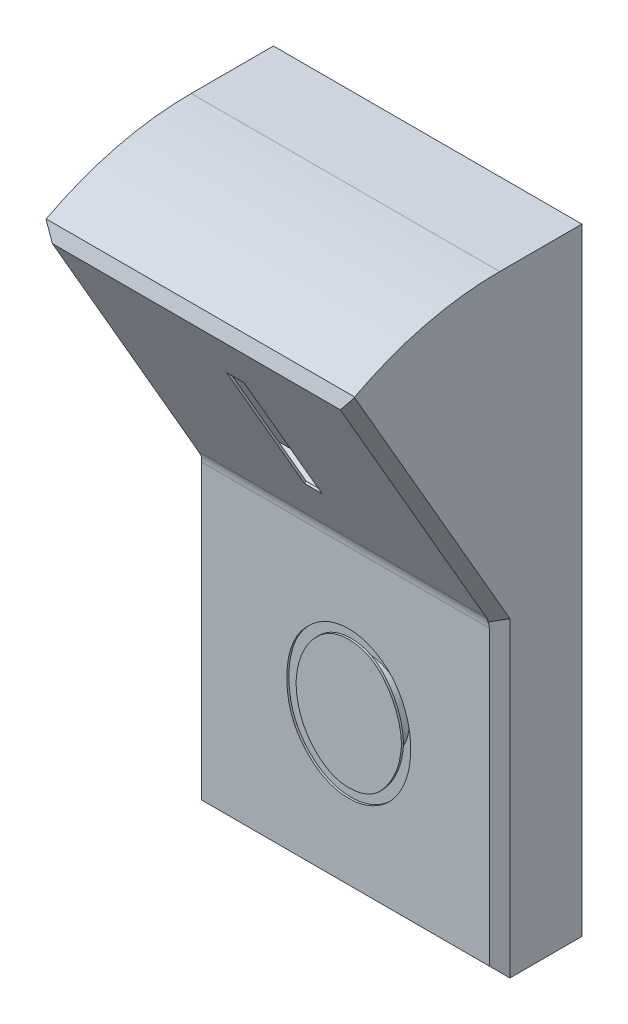
from build123d import *

# Parameters (mm, degrees)
RESSALTO_EXTRUS_O1_DEPTH = 15
FILETE1_R                = 1
CORTE_EXTRUS_O1_DEPTH    = 0.1
ESBO_O2_W                = 0.851600406
ESBO_O2_H                = 7.569781387
CORTE_EXTRUS_O2_DEPTH    = 0.1
ESBO_O5_W                = 10
ESBO_O5_H                = 9.639509302
CORTE_EXTRUS_O3_DEPTH    = 1
ESBO_O7_W                = 10
ESBO_O7_H                = 10
ESBO_O7_R                = 2
CORTE_EXTRUS_O4_DEPTH    = 1


with BuildPart() as part:
    # Esboço1 → Ressalto-extrusão1 (new body)
    with BuildSketch(Plane(origin=(0, 0, 0), x_dir=(0, 0, -1), z_dir=(1, 0, 0))):
        with BuildLine():
            Line((0, 0), (0, 30.000000051))
            Line((0, 30.000000051), (-3.998768252, 30.000000051))
            ThreePointArc((-3.998768252, 30.000000051), (-7.881698136, 29.488790089), (-11.5, 27.99))
            Line((-11.5, 27.99), (-4, 15))
            Line((-4, 15), (-4, 0))
            Line((-4, 0), (0, 0))
        make_face()
    extrude(amount=RESSALTO_EXTRUS_O1_DEPTH)

    # Chanfro1
    # the kernel refuses this chamfer: 0.5 mm, written as the material it takes off along each edge
    with BuildSketch(Plane(origin=(-1.285841494, 0, 4), x_dir=(0, 0.9996219169112968, 0.02749587661058563), z_dir=(1, 0, 0))) as chanfro1_piece_1:
        with BuildLine():
            Line((0.514336598, 0), (-0.028273577, -0.513558897))
            Line((-0.028273577, -0.513558897), (-0.038269797, -0.513283938))
            ThreePointArc((-0.038269797, -0.513283938), (-0.017064614, -0.256698915), (-0.009996219, 0.000274959))
            Line((-0.009996219, 0.000274959), (0.000274959, 0.009996219))
            ThreePointArc((0.000274959, 0.009996219), (0.257248832, 0.002927825), (0.514611556, 0.009996219))
            Line((0.514611556, 0.009996219), (0.514336598, 0))
        make_face()
    extrude(amount=17.571682988, mode=Mode.SUBTRACT)
    with BuildSketch(Plane(origin=(-1.329115007, 27.99, 11.5), x_dir=(0, 0.5080962440375398, -0.8613003000086236), z_dir=(1, 0, 0))) as chanfro1_piece_2:
        with BuildLine():
            Line((0.531646003, 0), (-0.019274737, -0.522360638))
            Line((-0.019274737, -0.522360638), (-0.029274299, -0.522267024))
            ThreePointArc((-0.029274299, -0.522267024), (-0.012445314, -0.261154032), (-0.009999562, 9.3614e-05))
            Line((-0.009999562, 9.3614e-05), (9.3614e-05, 0.009999562))
            ThreePointArc((9.3614e-05, 0.009999562), (0.265962617, 0.005155355), (0.532084323, 0.009990389))
            Line((0.532084323, 0.009990389), (0.531646003, 0))
        make_face()
    extrude(amount=17.658230014, mode=Mode.SUBTRACT)
    with BuildSketch(Plane(origin=(15, 29.103563232, 12.142934892), x_dir=(-0.9996219169112968, -0.01374824076991902, 0.023811953013499736), z_dir=(0, -0.866019052628739, -0.5000110003630134))) as chanfro1_piece_3_section:
        with BuildLine():
            Line((0.514336598, 0), (-0.028273577, 0.513558897))
            Line((-0.028273577, 0.513558897), (-0.038269797, 0.513283938))
            ThreePointArc((-0.038269797, 0.513283938), (-0.017064614, 0.256698915), (-0.009996219, -0.000274959))
            Line((-0.009996219, -0.000274959), (0.000274959, -0.009996219))
            ThreePointArc((0.000274959, -0.009996219), (0.257248832, -0.002927825), (0.514611556, -0.009996219))
            Line((0.514611556, -0.009996219), (0.514336598, 0))
        make_face()
    chanfro1_piece_3 = extrude(amount=17.571352984, mode=Mode.PRIVATE)
    chanfro1_piece_3 = split(chanfro1_piece_3, bisect_by=Plane(origin=(14.834184444, 22.255751757, 4), z_dir=(0, 0, 1)), keep=Keep.TOP, mode=Mode.PRIVATE)
    add(chanfro1_piece_3, mode=Mode.SUBTRACT)
    with BuildSketch(Plane(origin=(15, 16.285841494, 4), x_dir=(-0.9996219169112968, 0, 0.027495876610585647), z_dir=(0, -1, 0))) as chanfro1_piece_4_section:
        with BuildLine():
            Line((0.514336598, 0), (-0.028273577, 0.513558897))
            Line((-0.028273577, 0.513558897), (-0.038269797, 0.513283938))
            ThreePointArc((-0.038269797, 0.513283938), (-0.017064614, 0.256698915), (-0.009996219, -0.000274959))
            Line((-0.009996219, -0.000274959), (0.000274959, -0.009996219))
            ThreePointArc((0.000274959, -0.009996219), (0.257248832, -0.002927825), (0.514611556, -0.009996219))
            Line((0.514611556, -0.009996219), (0.514336598, 0))
        make_face()
    chanfro1_piece_4 = extrude(amount=17.571682988, mode=Mode.PRIVATE)
    chanfro1_piece_4 = split(chanfro1_piece_4, bisect_by=Plane(origin=(14.834184463, 8.71625695, 0.371972835), z_dir=(0, -0.5000110003630134, 0.866019052628739)), keep=Keep.TOP, mode=Mode.PRIVATE)
    add(chanfro1_piece_4, mode=Mode.SUBTRACT)
    with BuildSketch(Plane(origin=(0, 16.285841494, 4), x_dir=(0.9996219169112968, 0, 0.02749587661058563), z_dir=(0, -1, 0))) as chanfro1_piece_5_section:
        with BuildLine():
            Line((0.514336598, 0), (-0.028273577, -0.513558897))
            Line((-0.028273577, -0.513558897), (-0.038269797, -0.513283938))
            ThreePointArc((-0.038269797, -0.513283938), (-0.017064614, -0.256698915), (-0.009996219, 0.000274959))
            Line((-0.009996219, 0.000274959), (0.000274959, 0.009996219))
            ThreePointArc((0.000274959, 0.009996219), (0.257248832, 0.002927825), (0.514611556, 0.009996219))
            Line((0.514611556, 0.009996219), (0.514336598, 0))
        make_face()
    chanfro1_piece_5 = extrude(amount=17.571682988, mode=Mode.PRIVATE)
    chanfro1_piece_5 = split(chanfro1_piece_5, bisect_by=Plane(origin=(0.165815537, 8.71625695, 0.371972835), z_dir=(0, -0.5000110003630134, 0.866019052628739)), keep=Keep.TOP, mode=Mode.PRIVATE)
    add(chanfro1_piece_5, mode=Mode.SUBTRACT)
    with BuildSketch(Plane(origin=(0, 29.103563232, 12.142934892), x_dir=(0.9996219169112968, -0.01374824076991901, 0.023811953013499722), z_dir=(0, -0.866019052628739, -0.5000110003630134))) as chanfro1_piece_6_section:
        with BuildLine():
            Line((0.514336598, 0), (-0.028273577, -0.513558897))
            Line((-0.028273577, -0.513558897), (-0.038269797, -0.513283938))
            ThreePointArc((-0.038269797, -0.513283938), (-0.017064614, -0.256698915), (-0.009996219, 0.000274959))
            Line((-0.009996219, 0.000274959), (0.000274959, 0.009996219))
            ThreePointArc((0.000274959, 0.009996219), (0.257248832, 0.002927825), (0.514611556, 0.009996219))
            Line((0.514611556, 0.009996219), (0.514336598, 0))
        make_face()
    chanfro1_piece_6 = extrude(amount=17.571352984, mode=Mode.PRIVATE)
    chanfro1_piece_6 = split(chanfro1_piece_6, bisect_by=Plane(origin=(0.165815556, 22.255751757, 4), z_dir=(0, 0, 1)), keep=Keep.TOP, mode=Mode.PRIVATE)
    add(chanfro1_piece_6, mode=Mode.SUBTRACT)
    with BuildSketch(Plane(origin=(15, 29.103563232, 12.142934892), x_dir=(-0.9996219169112968, -0.01374824076991902, 0.023811953013499736), z_dir=(0, -0.866019052628739, -0.5000110003630134))) as chanfro1_piece_7a_section:
        with BuildLine():
            Line((0.514336598, 0), (-0.028273577, 0.513558897))
            Line((-0.028273577, 0.513558897), (-0.038269797, 0.513283938))
            ThreePointArc((-0.038269797, 0.513283938), (-0.017064614, 0.256698915), (-0.009996219, -0.000274959))
            Line((-0.009996219, -0.000274959), (0.000274959, -0.009996219))
            ThreePointArc((0.000274959, -0.009996219), (0.257248832, -0.002927825), (0.514611556, -0.009996219))
            Line((0.514611556, -0.009996219), (0.514336598, 0))
        make_face()
    chanfro1_piece_7a = extrude(amount=17.571352984, mode=Mode.PRIVATE)
    chanfro1_piece_7a = split(chanfro1_piece_7a, bisect_by=Plane(origin=(14.844457521, 14.67120849, 4), z_dir=(0, 0, -1)), keep=Keep.TOP, mode=Mode.PRIVATE)
    with BuildSketch(Plane(origin=(15, 16.285841494, 4), x_dir=(-0.9996219169112968, 0, 0.027495876610585647), z_dir=(0, -1, 0))) as chanfro1_piece_7b_section:
        with BuildLine():
            Line((0.514336598, 0), (-0.028273577, 0.513558897))
            Line((-0.028273577, 0.513558897), (-0.038269797, 0.513283938))
            ThreePointArc((-0.038269797, 0.513283938), (-0.017064614, 0.256698915), (-0.009996219, -0.000274959))
            Line((-0.009996219, -0.000274959), (0.000274959, -0.009996219))
            ThreePointArc((0.000274959, -0.009996219), (0.257248832, -0.002927825), (0.514611556, -0.009996219))
            Line((0.514611556, -0.009996219), (0.514336598, 0))
        make_face()
    chanfro1_piece_7b = extrude(amount=17.571682988, mode=Mode.PRIVATE)
    chanfro1_piece_7b = split(chanfro1_piece_7b, bisect_by=Plane(origin=(14.844457521, 15.284739712, 4.164399372), z_dir=(0, 0.5000110003630134, -0.866019052628739)), keep=Keep.TOP, mode=Mode.PRIVATE)
    chanfro1_piece_7 = chanfro1_piece_7a & chanfro1_piece_7b
    add(chanfro1_piece_7, mode=Mode.SUBTRACT)
    with BuildSketch(Plane(origin=(0, 29.103563232, 12.142934892), x_dir=(0.9996219169112968, -0.01374824076991901, 0.023811953013499722), z_dir=(0, -0.866019052628739, -0.5000110003630134))) as chanfro1_piece_8a_section:
        with BuildLine():
            Line((0.514336598, 0), (-0.028273577, -0.513558897))
            Line((-0.028273577, -0.513558897), (-0.038269797, -0.513283938))
            ThreePointArc((-0.038269797, -0.513283938), (-0.017064614, -0.256698915), (-0.009996219, 0.000274959))
            Line((-0.009996219, 0.000274959), (0.000274959, 0.009996219))
            ThreePointArc((0.000274959, 0.009996219), (0.257248832, 0.002927825), (0.514611556, 0.009996219))
            Line((0.514611556, 0.009996219), (0.514336598, 0))
        make_face()
    chanfro1_piece_8a = extrude(amount=17.571352984, mode=Mode.PRIVATE)
    chanfro1_piece_8a = split(chanfro1_piece_8a, bisect_by=Plane(origin=(0.155542479, 14.67120849, 4), z_dir=(0, 0, -1)), keep=Keep.TOP, mode=Mode.PRIVATE)
    with BuildSketch(Plane(origin=(0, 16.285841494, 4), x_dir=(0.9996219169112968, 0, 0.02749587661058563), z_dir=(0, -1, 0))) as chanfro1_piece_8b_section:
        with BuildLine():
            Line((0.514336598, 0), (-0.028273577, -0.513558897))
            Line((-0.028273577, -0.513558897), (-0.038269797, -0.513283938))
            ThreePointArc((-0.038269797, -0.513283938), (-0.017064614, -0.256698915), (-0.009996219, 0.000274959))
            Line((-0.009996219, 0.000274959), (0.000274959, 0.009996219))
            ThreePointArc((0.000274959, 0.009996219), (0.257248832, 0.002927825), (0.514611556, 0.009996219))
            Line((0.514611556, 0.009996219), (0.514336598, 0))
        make_face()
    chanfro1_piece_8b = extrude(amount=17.571682988, mode=Mode.PRIVATE)
    chanfro1_piece_8b = split(chanfro1_piece_8b, bisect_by=Plane(origin=(0.155542479, 15.284739712, 4.164399372), z_dir=(0, 0.5000110003630134, -0.866019052628739)), keep=Keep.TOP, mode=Mode.PRIVATE)
    chanfro1_piece_8 = chanfro1_piece_8a & chanfro1_piece_8b
    add(chanfro1_piece_8, mode=Mode.SUBTRACT)

    # Filete1
    filete1_edges = [part.edges().sort_by_distance(p)[0] for p in [
        (7.5, 15, 4),
    ]]
    fillet(filete1_edges, radius=FILETE1_R)

    # Esboço4 → Corte-extrusão1 (cut)
    with BuildSketch(Plane.XY.offset(4)):
        with BuildLine():
            add(Edge.make_bspline(
                [(10.677142464, 7.717861332), (10.675491893, 7.637643685), (10.672210966, 7.478190821), (10.65538923, 7.240566988), (10.623347331, 7.007332743), (10.580757754, 6.778196585), (10.521530651, 6.554832351), (10.455078991, 6.334528983), (10.371798484, 6.119765454), (10.278769369, 5.909951206), (10.174027491, 5.708256453), (10.061344868, 5.515853133), (9.937368217, 5.335686475), (9.802255278, 5.168293604), (9.659731297, 5.01096062), (9.506991195, 4.86540107), (9.345090035, 4.731371027), (9.174636706, 4.609171357), (8.99727128, 4.502252193), (8.816718527, 4.406838826), (8.632656274, 4.326585067), (8.444451996, 4.262773798), (8.254802385, 4.208290712), (8.060527696, 4.175816019), (7.863974081, 4.150598415), (7.731489385, 4.148479207), (7.66457316, 4.147408823)],
                knots=[0, 0, 0, 0, 1.112232891, 2.210844172, 3.300081163, 4.374499544, 5.439422096, 6.502026147, 7.562826816, 8.630306062, 9.682444482, 10.711789295, 11.719628984, 12.711074663, 13.691957169, 14.660655153, 15.63336488, 16.603602659, 17.565239823, 18.502160713, 19.433070182, 20.345174306, 21.255961054, 22.164607458, 23.072968101, 24, 24, 24, 24], degree=3))
            add(Edge.make_bspline(
                [(7.66457316, 4.147408823), (7.566159877, 4.150307832), (7.371670031, 4.156037015), (7.084636065, 4.205404923), (6.806491624, 4.283026108), (6.538010436, 4.395344378), (6.276421328, 4.534056052), (6.027137985, 4.709336817), (5.784699559, 4.912539502), (5.555454058, 5.146167763), (5.343776563, 5.403908656), (5.157616094, 5.681951296), (5.002598461, 5.979084138), (4.872469059, 6.291817419), (4.772595359, 6.623614607), (4.705040321, 6.973040142), (4.658837633, 7.339482543), (4.654315579, 7.589863759), (4.652003856, 7.717861332)],
                knots=[0, 0, 0, 0, 0.909166022, 1.796744864, 2.684453754, 3.573332222, 4.481847292, 5.41618573, 6.384649117, 7.402709214, 8.437233447, 9.463804637, 10.489883747, 11.530416076, 12.590906446, 13.686597692, 14.817363838, 16, 16, 16, 16], degree=3))
            add(Edge.make_bspline(
                [(4.652003856, 7.717861332), (4.654351194, 7.845854009), (4.658953504, 8.096802954), (4.704817807, 8.463881899), (4.772914354, 8.814337975), (4.87210068, 9.14692119), (5.002625371, 9.460122794), (5.15765814, 9.757226091), (5.343330676, 10.035058039), (5.555341937, 10.291548896), (5.785957778, 10.522899205), (6.025814065, 10.728757772), (6.277655638, 10.900792935), (6.536977624, 11.04308332), (6.807016281, 11.152058947), (7.084552761, 11.230503451), (7.371691448, 11.279637905), (7.566167073, 11.285398791), (7.66457316, 11.288313841)],
                knots=[0, 0, 0, 0, 1.182381368, 2.318236969, 3.413692153, 4.479097322, 5.519405472, 6.545263518, 7.571613538, 8.601764894, 9.615786618, 10.587505976, 11.518596411, 12.429468701, 13.316124599, 14.203642237, 15.091029854, 16, 16, 16, 16], degree=3))
            add(Edge.make_bspline(
                [(7.66457316, 11.288313841), (7.731476328, 11.287178127), (7.863935174, 11.284929573), (8.060784597, 11.260654251), (8.254288991, 11.224560055), (8.444743052, 11.173569163), (8.632270949, 11.10946206), (8.815579819, 11.027802727), (8.997268221, 10.934862635), (9.172559362, 10.823879659), (9.342745146, 10.703232049), (9.504230646, 10.569868351), (9.655534501, 10.424703596), (9.799997583, 10.26906524), (9.932820526, 10.100361538), (10.057671679, 9.921236268), (10.17310707, 9.731183126), (10.276316989, 9.529507568), (10.370760826, 9.320894644), (10.452496074, 9.105983505), (10.523117676, 8.886297831), (10.577425263, 8.660954579), (10.624198013, 8.432173987), (10.655261664, 8.19801895), (10.672253355, 7.959284368), (10.67550612, 7.798663607), (10.677142464, 7.717861332)],
                knots=[0, 0, 0, 0, 0.927239978, 1.835804509, 2.746118307, 3.655004384, 4.567313236, 5.491045181, 6.435320531, 7.394537119, 8.364992675, 9.326575615, 10.29549103, 11.270652298, 12.268619163, 13.270060955, 14.296858096, 15.349232675, 16.409598064, 17.470636838, 18.535889856, 19.606887649, 20.683086841, 21.772568318, 22.879462736, 24, 24, 24, 24], degree=3))
        make_face()
        with BuildLine():
            add(Edge.make_bspline(
                [(10.230835901, 7.717861332), (10.224149096, 7.817384754), (10.210919696, 8.014285252), (10.165889121, 8.304818145), (10.10440883, 8.588623605), (10.017942552, 8.863782701), (9.913350657, 9.131294998), (9.789000181, 9.390824574), (9.643558179, 9.642358317), (9.480297946, 9.883811377), (9.30130714, 10.107636689), (9.107673193, 10.305382764), (8.897902322, 10.469683372), (8.677640595, 10.608267408), (8.441803115, 10.712677065), (8.194402778, 10.788602114), (7.933446805, 10.8325239), (7.755391648, 10.838804041), (7.66457316, 10.842007278)],
                knots=[0, 0, 0, 0, 1.072945641, 2.122751872, 3.160550073, 4.195045731, 5.222790319, 6.249316523, 7.288715031, 8.346758945, 9.38299211, 10.369101689, 11.317447082, 12.244164047, 13.162316996, 14.084168162, 15.022814312, 16, 16, 16, 16], degree=3))
            add(Edge.make_bspline(
                [(7.66457316, 10.842007278), (7.578951813, 10.839565255), (7.41004619, 10.834747864), (7.162474672, 10.789306497), (6.924593315, 10.717031705), (6.694989062, 10.617864996), (6.476268571, 10.487219539), (6.267009132, 10.328746298), (6.068400439, 10.140665945), (5.879956973, 9.927744423), (5.707589059, 9.694780855), (5.555074142, 9.447371831), (5.423463422, 9.188842243), (5.315600507, 8.917151559), (5.228087427, 8.633834871), (5.162607375, 8.33878598), (5.115565833, 8.032436858), (5.104121062, 7.823792485), (5.098310419, 7.717861332)],
                knots=[0, 0, 0, 0, 0.920751586, 1.816370871, 2.698790093, 3.592310473, 4.500830444, 5.433988683, 6.411851609, 7.439738322, 8.490489621, 9.526714784, 10.564429984, 11.608533727, 12.668901603, 13.752279013, 14.858806142, 16, 16, 16, 16], degree=3))
            add(Edge.make_bspline(
                [(5.098310419, 7.717861332), (5.103916197, 7.605518764), (5.114911362, 7.385170178), (5.164224192, 7.063834288), (5.230261511, 6.757014391), (5.324040601, 6.467168505), (5.436465785, 6.1922159), (5.573699539, 5.933493099), (5.734734435, 5.691483653), (5.91436711, 5.465608967), (6.110780968, 5.264158888), (6.312570348, 5.084090072), (6.52307409, 4.933987063), (6.738199671, 4.808252439), (6.961169517, 4.711541801), (7.190613348, 4.643440575), (7.42598174, 4.602087566), (7.584795851, 4.596514775), (7.66457316, 4.593715387)],
                knots=[0, 0, 0, 0, 1.210157347, 2.373601246, 3.495271046, 4.585425916, 5.648479198, 6.689565086, 7.732378856, 8.773896982, 9.791503928, 10.757859102, 11.68147193, 12.569965943, 13.435793289, 14.290886071, 15.141458466, 16, 16, 16, 16], degree=3))
            add(Edge.make_bspline(
                [(7.66457316, 4.593715387), (7.755393406, 4.596915746), (7.93345201, 4.603190245), (8.19438306, 4.647152826), (8.441875555, 4.722927027), (8.677091244, 4.82777369), (8.898422511, 4.964014542), (9.107660587, 5.12867529), (9.300729799, 5.326210469), (9.480871416, 5.54854368), (9.643490833, 5.789938842), (9.788953577, 6.04141911), (9.913834466, 6.301339386), (10.017157537, 6.569308064), (10.105052944, 6.844589634), (10.165784446, 7.129206023), (10.210834308, 7.420864495), (10.224133398, 7.618338151), (10.230835901, 7.717861332)],
                knots=[0, 0, 0, 0, 0.976941104, 1.915352318, 2.83697275, 3.754895891, 4.678105416, 5.626213443, 6.612076206, 7.643190205, 8.700969298, 9.740107651, 10.766376922, 11.799687281, 12.827954204, 13.8715967, 14.92732291, 16, 16, 16, 16], degree=3))
        make_face(mode=Mode.SUBTRACT)
    extrude(amount=-CORTE_EXTRUS_O1_DEPTH, mode=Mode.SUBTRACT)

    # Esboço2 → Corte-extrusão2 (cut)
    with BuildSketch(Plane(origin=(0, 2.018088796, -3.495329795), x_dir=(1, 0, 0), z_dir=(0, -0.5000110003630135, 0.866019052628739))):
        with Locations((7.75602892, 22.420928057)):
            Rectangle(ESBO_O2_W, ESBO_O2_H)
    extrude(amount=-CORTE_EXTRUS_O2_DEPTH, mode=Mode.SUBTRACT)

    # Esboço5 → Corte-extrusão3 (cut)
    with BuildSketch(Plane(origin=(0, 2.068089896, -3.5819317), x_dir=(1, 0, 0), z_dir=(0, -0.5000110003630135, 0.866019052628739))):
        with Locations((7.5, 22.420928056)):
            Rectangle(ESBO_O5_W, ESBO_O5_H)
    extrude(amount=-CORTE_EXTRUS_O3_DEPTH, mode=Mode.SUBTRACT)

    # Esboço7 → Corte-extrusão4 (cut)
    with BuildSketch(Plane.XY.offset(3.9)):
        with Locations((7.5, 7.616022)):
            Rectangle(ESBO_O7_W, ESBO_O7_H)
        with Locations((7.5, 7.616022)):
            Circle(ESBO_O7_R, mode=Mode.SUBTRACT)
    extrude(amount=-CORTE_EXTRUS_O4_DEPTH, mode=Mode.SUBTRACT)


solid = part.part
